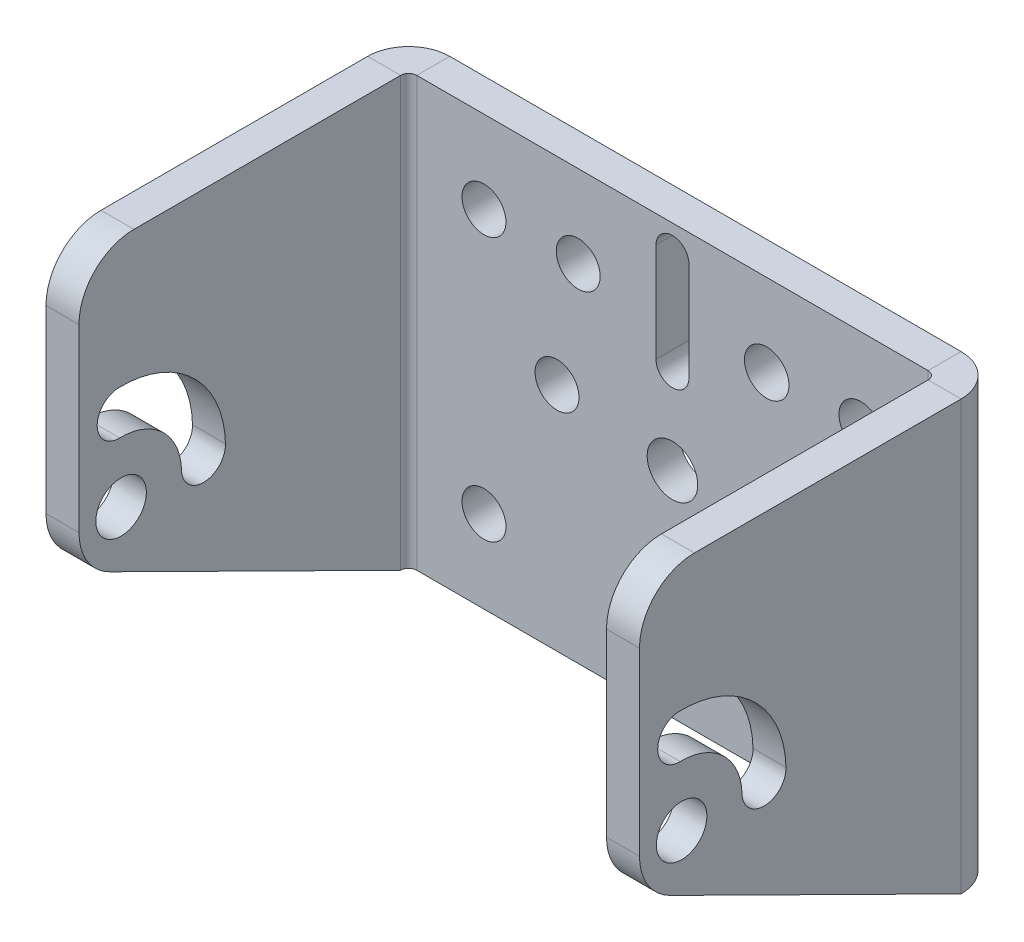
from build123d import *

# Parameters (mm, degrees)
ESBO_O1_W                        = 48
ESBO_O1_H                        = 39
FLANGE_BASE1_DEPTH               = 3
ESBO_O6_R                        = 2.3
CORTE_EXTRUS_O1_DEPTH            = 10
ARESTA_FLANGE1_STRIP_W           = 13.4732
ARESTA_FLANGE1_STRIP_H           = 3
ARESTA_FLANGE1_STRIP_CUT_DEPTH   = 39
ARESTA_FLANGE1_STRIP_2_W         = 13.4732
ARESTA_FLANGE1_STRIP_2_H         = 3
ARESTA_FLANGE1_STRIP_CUT_2_DEPTH = 39
ARESTA_FLANGE1_DEPTH             = 39
ARESTA_FLANGE1_BEND_DEPTH        = 39
ESBO_O13_R                       = 2.3
CORTE_EXTRUS_O2_DEPTH            = 70
FILETE1_R                        = 5
ESBO_O14_R                       = 1.997873176
ESBO_O14_R_2                     = 2.026064888
ESBO_O14_R_3                     = 2
CORTE_EXTRUS_O4_DEPTH            = 3


# Sheet-metal steps are written as plain solids
with BuildPart() as part:
    # Esboço1 → Flange-base1 (new body)
    with BuildSketch(Plane.XY):
        with Locations((2.993735783, -4.490936556)):
            Rectangle(ESBO_O1_W, ESBO_O1_H)
    extrude(amount=-FLANGE_BASE1_DEPTH)

    # Esboço6 → Corte-extrusão1 (cut)
    with BuildSketch(Plane.XY):
        with BuildLine():
            Line((-14.156264217, 5.509063444), (-14.156264217, 7.509063444))
            Line((-14.156264217, 7.509063444), (-12.156264217, 7.509063444))
            ThreePointArc((-12.156264217, 7.509063444), (-15.570477779, 8.923277006), (-14.156264217, 5.509063444))
        make_face()
        with BuildLine():
            Line((-12.156264217, 7.509063444), (-14.156264217, 7.509063444))
            Line((-14.156264217, 7.509063444), (-14.156264217, 5.509063444))
            ThreePointArc((-14.156264217, 5.509063444), (-12.742050654, 6.094849882), (-12.156264217, 7.509063444))
        make_face()
        with BuildLine():
            ThreePointArc((-12.156264217, -16.490936556), (-12.742050654, -15.076722994), (-14.156264217, -14.490936556))
            Line((-14.156264217, -14.490936556), (-14.156264217, -16.490936556))
            Line((-14.156264217, -16.490936556), (-12.156264217, -16.490936556))
        make_face()
        with BuildLine():
            Line((-14.156264217, -16.490936556), (-14.156264217, -14.490936556))
            ThreePointArc((-14.156264217, -14.490936556), (-15.570477779, -17.905150118), (-12.156264217, -16.490936556))
            Line((-12.156264217, -16.490936556), (-14.156264217, -16.490936556))
        make_face()
        with Locations((2.993735783, -4.490936556)):
            Circle(ESBO_O6_R)
        with BuildLine():
            Line((4.493735783, 7.509063444), (1.493735783, 7.509063444))
            Line((1.493735783, 7.509063444), (1.493735783, 3.523823043))
            ThreePointArc((1.493735783, 3.523823043), (2.993735783, 2.023823043), (4.493735783, 3.523823043))
            Line((4.493735783, 3.523823043), (4.493735783, 7.509063444))
        make_face()
        with BuildLine():
            Line((1.493735783, 12.523823043), (1.493735783, 7.509063444))
            Line((1.493735783, 7.509063444), (4.493735783, 7.509063444))
            Line((4.493735783, 7.509063444), (4.493735783, 12.523823043))
            ThreePointArc((4.493735783, 12.523823043), (2.993735783, 14.023823043), (1.493735783, 12.523823043))
        make_face()
        with BuildLine():
            Line((1.493735783, -12.505696155), (1.493735783, -16.490936556))
            Line((1.493735783, -16.490936556), (4.493735783, -16.490936556))
            Line((4.493735783, -16.490936556), (4.493735783, -12.505696155))
            ThreePointArc((4.493735783, -12.505696155), (2.993735783, -11.005696155), (1.493735783, -12.505696155))
        make_face()
        with BuildLine():
            Line((4.493735783, -16.490936556), (1.493735783, -16.490936556))
            Line((1.493735783, -16.490936556), (1.493735783, -21.505696155))
            ThreePointArc((1.493735783, -21.505696155), (2.993735783, -23.005696155), (4.493735783, -21.505696155))
            Line((4.493735783, -21.505696155), (4.493735783, -16.490936556))
        make_face()
        with BuildLine():
            ThreePointArc((22.143735783, -16.490936556), (21.557949346, -15.076722994), (20.143735783, -14.490936556))
            Line((20.143735783, -14.490936556), (20.143735783, -16.490936556))
            Line((20.143735783, -16.490936556), (18.143735783, -16.490936556))
            ThreePointArc((18.143735783, -16.490936556), (20.143735783, -18.490936556), (22.143735783, -16.490936556))
        make_face()
        with BuildLine():
            Line((20.143735783, -16.490936556), (20.143735783, -14.490936556))
            ThreePointArc((20.143735783, -14.490936556), (18.729522221, -15.076722994), (18.143735783, -16.490936556))
            Line((18.143735783, -16.490936556), (20.143735783, -16.490936556))
        make_face()
        with BuildLine():
            ThreePointArc((22.143735783, 7.509063444), (20.143735783, 9.509063444), (18.143735783, 7.509063444))
            Line((18.143735783, 7.509063444), (20.143735783, 7.509063444))
            Line((20.143735783, 7.509063444), (20.143735783, 5.509063444))
            ThreePointArc((20.143735783, 5.509063444), (21.557949346, 6.094849882), (22.143735783, 7.509063444))
        make_face()
        with BuildLine():
            Line((20.143735783, 7.509063444), (18.143735783, 7.509063444))
            ThreePointArc((18.143735783, 7.509063444), (18.729522221, 6.094849882), (20.143735783, 5.509063444))
            Line((20.143735783, 5.509063444), (20.143735783, 7.509063444))
        make_face()
    extrude(amount=-CORTE_EXTRUS_O1_DEPTH, mode=Mode.SUBTRACT)

    # Aresta-Flange1 strip (across the edge) → Aresta-Flange1 strip cut (cut)
    with BuildSketch(Plane(origin=(26.993735783, -23.990936556, 0), x_dir=(-1, 0, 0), z_dir=(0, 1, 0))):
        with Locations((-6, -1.5)):
            Rectangle(ARESTA_FLANGE1_STRIP_W, ARESTA_FLANGE1_STRIP_H)
    extrude(amount=ARESTA_FLANGE1_STRIP_CUT_DEPTH, mode=Mode.SUBTRACT)

    # Aresta-Flange1 strip 2 (across the edge) → Aresta-Flange1 strip cut 2 (cut)
    with BuildSketch(Plane(origin=(-21.006264217, 15.009063444, 0), x_dir=(1, 0, 0), z_dir=(0, -1, 0))):
        with Locations((-6, -1.5)):
            Rectangle(ARESTA_FLANGE1_STRIP_2_W, ARESTA_FLANGE1_STRIP_2_H)
    extrude(amount=ARESTA_FLANGE1_STRIP_CUT_2_DEPTH, mode=Mode.SUBTRACT)

    # Aresta-Flange1 section (across the edge) → Aresta-Flange1 (add)
    with BuildSketch(Plane(origin=(26.993735783, -23.990936556, 0), x_dir=(-1, 0, 0), z_dir=(0, 1, 0))):
        with BuildLine():
            Line((-3, 0.7366), (-3, 30))
            Line((-3, 30), (0, 30))
            Line((0, 30), (0, 0.7366))
            ThreePointArc((0, 0.7366), (0.215745145, 0.215745145), (0.7366, 0))
            Line((0.7366, 0), (0.7366, -3))
            ThreePointArc((0.7366, -3), (-1.905575199, -1.905575199), (-3, 0.7366))
        make_face()
    extrude(amount=ARESTA_FLANGE1_DEPTH)

    # Aresta-Flange1 section 2 (across the edge) → Aresta-Flange1 bend (add)
    with BuildSketch(Plane(origin=(-21.006264217, 15.009063444, 0), x_dir=(1, 0, 0), z_dir=(0, -1, 0))):
        with BuildLine():
            Line((-3, 0.7366), (-3, 30))
            Line((-3, 30), (0, 30))
            Line((0, 30), (0, 0.7366))
            ThreePointArc((0, 0.7366), (0.215745145, 0.215745145), (0.7366, 0))
            Line((0.7366, 0), (0.7366, -3))
            ThreePointArc((0.7366, -3), (-1.905575199, -1.905575199), (-3, 0.7366))
        make_face()
    extrude(amount=ARESTA_FLANGE1_BEND_DEPTH)

    # Esboço13 → Corte-extrusão2 (cut)
    with BuildSketch(Plane.ZY.offset(24.006264217)):
        with Locations((26.166238029, -6.281221748)):
            Circle(ESBO_O13_R)
        Polygon((0.7366, -23.990936556), (30, -23.990936556), (30, -9.490936556), align=None)
        with BuildLine():
            ThreePointArc((26.391219924, 3.216113833), (19.60969386, 0.593494869), (16.668902447, -6.056239853))
            ThreePointArc((16.668902447, -6.056239853), (18.620976907, -8.103043532), (20.667780587, -6.150969072))
            ThreePointArc((20.667780587, -6.150969072), (22.370344036, -2.301122654), (26.296490705, -0.782764306))
            ThreePointArc((26.296490705, -0.782764306), (28.343294384, 1.169310154), (26.391219924, 3.216113833))
        make_face()
    extrude(amount=-CORTE_EXTRUS_O2_DEPTH, mode=Mode.SUBTRACT)

    # Filete1
    filete1_edges = [part.edges().sort_by_distance(p)[0] for p in [
        (28.493735783, 15.009063444, 30),
        (-22.506264217, 15.009063444, 30),
        (-22.506264217, -9.490936556, 30),
        (28.493735783, -9.490936556, 30),
    ]]
    fillet(filete1_edges, radius=FILETE1_R)

    # Esboço14 → Corte-extrusão4 (cut)
    with BuildSketch(Plane.XY):
        with Locations((-5.581264217, 7.509063444)):
            Circle(ESBO_O14_R)
        with Locations((11.568735783, 7.509063444)):
            Circle(ESBO_O14_R_2)
        with Locations((13.493735783, -2.990936556)):
            Circle(ESBO_O14_R_3)
        with Locations(Location((-7.506264217, -2.990936556, 0), (0, 0, 180))):
            Circle(ESBO_O14_R_3)
    extrude(amount=-CORTE_EXTRUS_O4_DEPTH, mode=Mode.SUBTRACT)


solid = part.part
